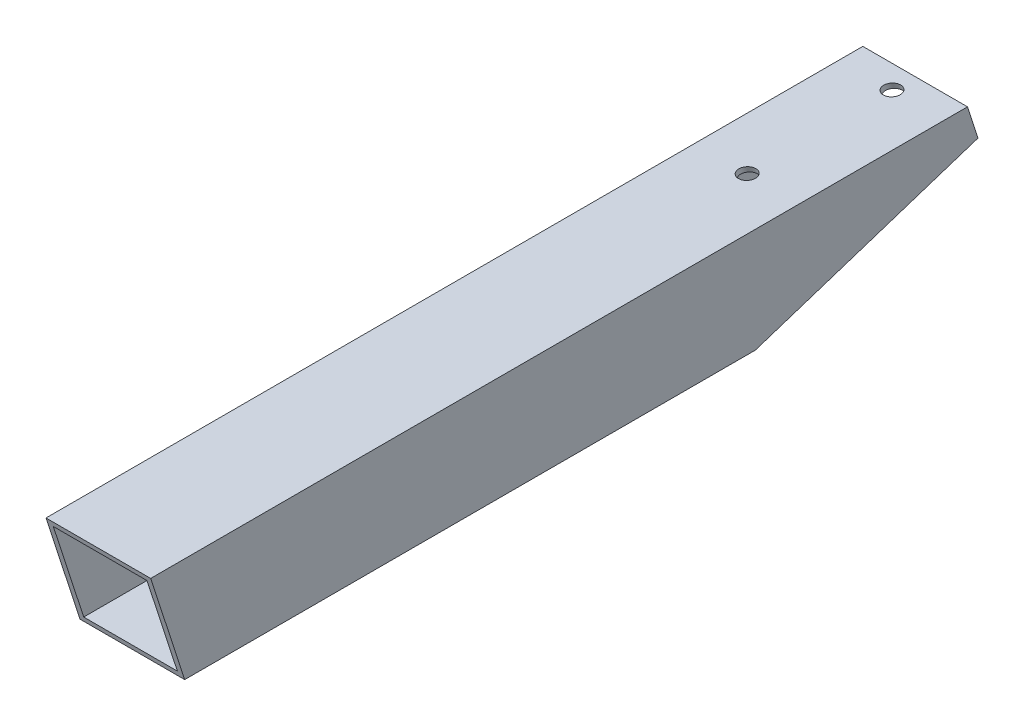
from build123d import *

# Parameters (mm, degrees)
ESBO_O1_W                = 19
ESBO_O1_H                = 19
RESSALTO_EXTRUS_O1_DEPTH = 260
CASCA2_T                 = -1
CORTE_EXTRUS_O1_DEPTH    = 261.866345089
CORTE_EXTRUS_O3_DEPTH    = 261.866345089
ESBO_O5_R                = 1.5
CORTE_EXTRUS_O4_DEPTH    = 170.569790677
ESBO_O7_W                = 19
ESBO_O7_H                = 19
CORTE_EXTRUS_O6_DEPTH    = 167.699273913


with BuildPart() as part:
    # Esboço1 → Ressalto-extrusão1 (new body)
    with BuildSketch(Plane.XY):
        Rectangle(ESBO_O1_W, ESBO_O1_H)
    extrude(amount=RESSALTO_EXTRUS_O1_DEPTH)

    # Casca2
    casca2_openings = [part.faces().sort_by_distance(p)[0] for p in [
        (0, 0, 0),
        (0, 0, 260),
    ]]
    offset(amount=CASCA2_T, openings=casca2_openings, kind=Kind.INTERSECTION)

    # Esboço2 → Corte-extrusão1 (cut, through all)
    with BuildSketch(Plane(origin=(9.5, 0, 0), x_dir=(0, 0, -1), z_dir=(1, 0, 0))):
        Polygon((0, 9.5), (-58.475987206, -9.5), (0, -9.5), align=None)
    extrude(amount=-CORTE_EXTRUS_O1_DEPTH, mode=Mode.SUBTRACT)

    # Esboço4 → Corte-extrusão3 (cut, through all)
    with BuildSketch(Plane(origin=(9.5, 0, 0), x_dir=(0, 0, -1), z_dir=(1, 0, 0))):
        Polygon((-168.550335734, 10.473717073), (-161.289503816, -11.872825786), (-264.812755879, -45.509569399), (-289.05777752, 22.149749677), (-184.516070462, 59.611196004), align=None)
    extrude(amount=-CORTE_EXTRUS_O3_DEPTH, mode=Mode.SUBTRACT)

    # Esboço5 → Corte-extrusão4 (cut, through all)
    with BuildSketch(Plane(origin=(0, 9.5, 0), x_dir=(1, 0, 0), z_dir=(0, 0.9510565162951555, 0.3090169943749416))):
        with Locations((0, -23)):
            Circle(ESBO_O5_R)
        with Locations((0, -48)):
            Circle(ESBO_O5_R)
    extrude(amount=CORTE_EXTRUS_O4_DEPTH, mode=Mode.SUBTRACT)

    # Esboço7 → Corte-extrusão6 (cut, through all)
    with BuildSketch(Plane(origin=(0, 8.592830723, 2.791979948), x_dir=(1, 0, 0), z_dir=(0, -0.9510565162951555, -0.3090169943749416))):
        with Locations((0, 6.564338553)):
            Rectangle(ESBO_O7_W, ESBO_O7_H)
    extrude(amount=-CORTE_EXTRUS_O6_DEPTH, mode=Mode.SUBTRACT)


solid = part.part
